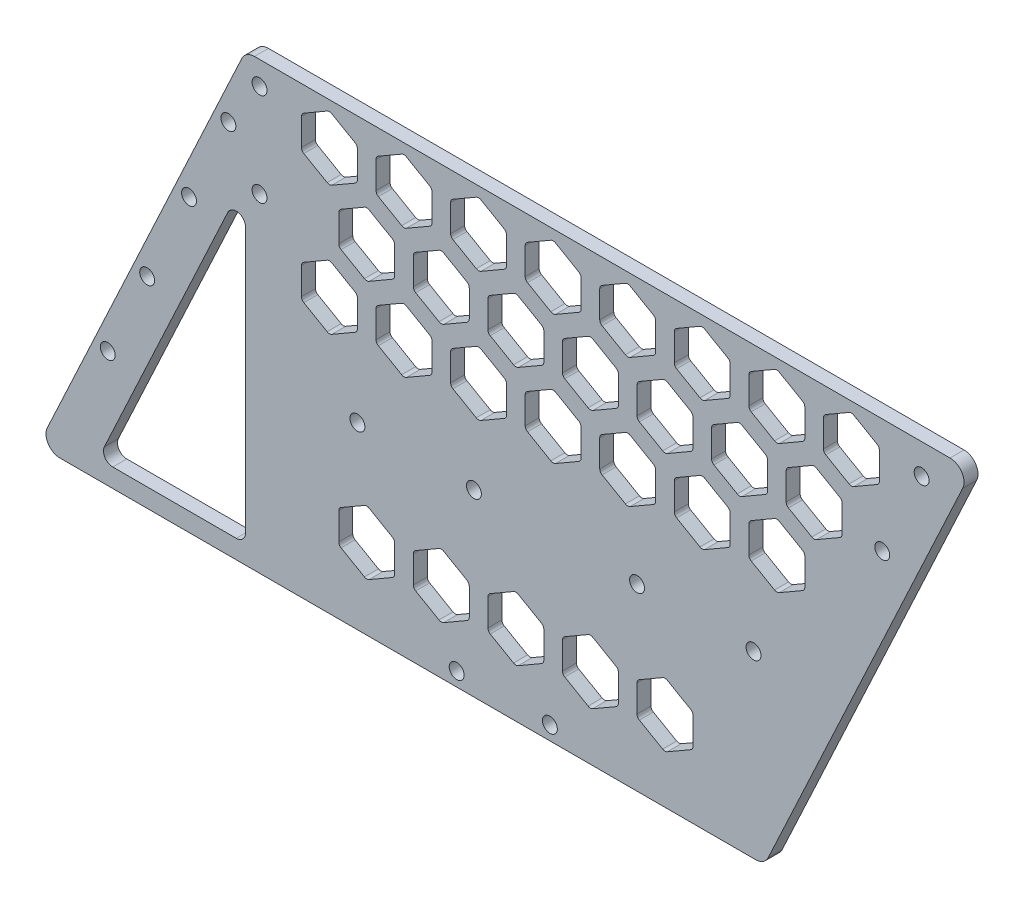
from build123d import *

# Parameters (mm, degrees)
EXTRUDE_1_DEPTH     = 3
CUT_EXTRUDE_1_REACH = 186.492
SKETCH_2_R          = 1.6
CUT_EXTRUDE_3_REACH = 186.492
SKETCH_4_R          = 1.6
CUT_EXTRUDE_4_REACH = 186.492
OTHER_1_DEPTH       = 3
CUT_EXTRUDE_5_REACH = 186.492
SKETCH_7_R          = 1.6
CUT_EXTRUDE_6_DEPTH = 10
SKETCH_9_R          = 1.6
CUT_EXTRUDE_7_DEPTH = 10
CUT_EXTRUDE_8_DEPTH = 10
FILLET_1_R          = 3
SKETCH_11_R         = 1.6
CUT_EXTRUDE_9_DEPTH = 10


# Read off the part's stored shape, not the designer's step: 填充阵列1
with BuildPart() as part:
    # 草图1 → 凸台-拉伸1 (new body)
    with BuildSketch(Plane.XY):
        with BuildLine():
            Line((0, 0), (113.088789218, 0))
            ThreePointArc((113.088789218, 0), (114.700688043, 0.469825663), (115.807712579, 1.732145215))
            Line((115.807712579, 1.732145215), (157.542247984, 91.232145215))
            ThreePointArc((157.542247984, 91.232145215), (157.35349896, 94.111898825), (154.823324622, 95.5))
            Line((154.823324622, 95.5), (0, 95.5))
            Line((0, 95.5), (-7.088789218, 95.5))
            ThreePointArc((-7.088789218, 95.5), (-8.700688043, 95.030174337), (-9.807712579, 93.767854785))
            Line((-9.807712579, 93.767854785), (-51.542247984, 4.267854785))
            ThreePointArc((-51.542247984, 4.267854785), (-51.35349896, 1.388101175), (-48.823324622, 0))
            Line((-48.823324622, 0), (0, 0))
        make_face()
    extrude(amount=EXTRUDE_1_DEPTH)

    # 草图2 → 切除-拉伸1 (cut, up to next)
    with BuildSketch(Plane.XY.offset(3), mode=Mode.PRIVATE) as cut_extrude_1_sk1:
        with Locations((15, 38.5)):
            Circle(SKETCH_2_R)
    cut_extrude_1_tool1 = extrude(cut_extrude_1_sk1.sketch, amount=-CUT_EXTRUDE_1_REACH, mode=Mode.PRIVATE) & part.part
    # 草图2 → 切除-拉伸1 (cut, up to next)
    with BuildSketch(Plane.XY.offset(3), mode=Mode.PRIVATE) as cut_extrude_1_sk2:
        with Locations((40, 38.5)):
            Circle(SKETCH_2_R)
    cut_extrude_1_tool2 = extrude(cut_extrude_1_sk2.sketch, amount=-CUT_EXTRUDE_1_REACH, mode=Mode.PRIVATE) & part.part
    # 草图2 → 切除-拉伸1 (cut, up to next)
    with BuildSketch(Plane.XY.offset(3), mode=Mode.PRIVATE) as cut_extrude_1_sk3:
        with Locations((75, 38.5)):
            Circle(SKETCH_2_R)
    cut_extrude_1_tool3 = extrude(cut_extrude_1_sk3.sketch, amount=-CUT_EXTRUDE_1_REACH, mode=Mode.PRIVATE) & part.part
    # 草图2 → 切除-拉伸1 (cut, up to next)
    with BuildSketch(Plane.XY.offset(3), mode=Mode.PRIVATE) as cut_extrude_1_sk4:
        with Locations((100, 38.5)):
            Circle(SKETCH_2_R)
    cut_extrude_1_tool4 = extrude(cut_extrude_1_sk4.sketch, amount=-CUT_EXTRUDE_1_REACH, mode=Mode.PRIVATE) & part.part
    add(cut_extrude_1_tool1.solids().sort_by_distance((15, 38.5, 3))[0], mode=Mode.SUBTRACT)
    add(cut_extrude_1_tool2.solids().sort_by_distance((40, 38.5, 3))[0], mode=Mode.SUBTRACT)
    add(cut_extrude_1_tool3.solids().sort_by_distance((75, 38.5, 3))[0], mode=Mode.SUBTRACT)
    add(cut_extrude_1_tool4.solids().sort_by_distance((100, 38.5, 3))[0], mode=Mode.SUBTRACT)

    # 草图4 → 切除-拉伸3 (cut, up to next)
    with BuildSketch(Plane.XY.offset(3), mode=Mode.PRIVATE) as cut_extrude_3_sk1:
        with Locations((136.072733418, 89.06)):
            Circle(SKETCH_4_R)
    cut_extrude_3_tool1 = extrude(cut_extrude_3_sk1.sketch, amount=-CUT_EXTRUDE_3_REACH, mode=Mode.PRIVATE) & part.part
    # 草图4 → 切除-拉伸3 (cut, up to next)
    with BuildSketch(Plane.XY.offset(3), mode=Mode.PRIVATE) as cut_extrude_3_sk2:
        with Locations((127.620368183, 70.933844259)):
            Circle(SKETCH_4_R)
    cut_extrude_3_tool2 = extrude(cut_extrude_3_sk2.sketch, amount=-CUT_EXTRUDE_3_REACH, mode=Mode.PRIVATE) & part.part
    add(cut_extrude_3_tool1.solids().sort_by_distance((136.072733, 89.06, 3))[0], mode=Mode.SUBTRACT)
    add(cut_extrude_3_tool2.solids().sort_by_distance((127.620368, 70.933844, 3))[0], mode=Mode.SUBTRACT)

    # 草图5 → 切除-拉伸4 (cut, up to next)
    with BuildSketch(Plane.XY.offset(3), mode=Mode.PRIVATE) as cut_extrude_4_sk1:
        with BuildLine():
            Line((9.5, 79.860471904), (14.5, 82.74722325))
            ThreePointArc((14.5, 82.74722325), (14.866025404, 83.113248654), (15, 83.613248654))
            Line((15, 83.613248654), (15, 89.386751346))
            ThreePointArc((15, 89.386751346), (14.866025404, 89.886751346), (14.5, 90.25277675))
            Line((14.5, 90.25277675), (9.5, 93.139528096))
            ThreePointArc((9.5, 93.139528096), (9, 93.273502692), (8.5, 93.139528096))
            Line((8.5, 93.139528096), (3.5, 90.25277675))
            ThreePointArc((3.5, 90.25277675), (3.133974596, 89.886751346), (3, 89.386751346))
            Line((3, 89.386751346), (3, 83.613248654))
            ThreePointArc((3, 83.613248654), (3.133974596, 83.113248654), (3.5, 82.74722325))
            Line((3.5, 82.74722325), (8.5, 79.860471904))
            ThreePointArc((8.5, 79.860471904), (9, 79.726497308), (9.5, 79.860471904))
        make_face()
    cut_extrude_4_tool1 = extrude(cut_extrude_4_sk1.sketch, amount=-CUT_EXTRUDE_4_REACH, mode=Mode.PRIVATE) & part.part
    add(cut_extrude_4_tool1.solids().sort_by_distance((9, 86.5, 3))[0], mode=Mode.SUBTRACT)

    # 填充阵列1 outline → 填充阵列1 (cut)
    with BuildSketch(Plane.XY):
        with BuildLine():
            ThreePointArc((27, 69.756842194), (27.133974596, 69.256842194), (27.5, 68.89081679))
            Line((27.5, 68.89081679), (32.5, 66.004065444))
            ThreePointArc((32.5, 66.004065444), (33, 65.870090848), (33.5, 66.004065444))
            Line((33.5, 66.004065444), (38.5, 68.89081679))
            ThreePointArc((38.5, 68.89081679), (38.866025404, 69.256842194), (39, 69.756842194))
            Line((39, 69.756842194), (39, 75.530344885))
            ThreePointArc((39, 75.530344885), (38.866025404, 76.030344885), (38.5, 76.396370289))
            Line((38.5, 76.396370289), (33.5, 79.283121635))
            ThreePointArc((33.5, 79.283121635), (33, 79.417096231), (32.5, 79.283121635))
            Line((32.5, 79.283121635), (27.5, 76.396370289))
            ThreePointArc((27.5, 76.396370289), (27.133974596, 76.030344885), (27, 75.530344885))
            Line((27, 75.530344885), (27, 69.756842194))
        make_face()
        with BuildLine():
            ThreePointArc((51, 55.900435733), (51.133974596, 55.400435733), (51.5, 55.034410329))
            Line((51.5, 55.034410329), (56.5, 52.147658983))
            ThreePointArc((56.5, 52.147658983), (57, 52.013684387), (57.5, 52.147658983))
            Line((57.5, 52.147658983), (62.5, 55.034410329))
            ThreePointArc((62.5, 55.034410329), (62.866025404, 55.400435733), (63, 55.900435733))
            Line((63, 55.900435733), (63, 61.673938425))
            ThreePointArc((63, 61.673938425), (62.866025404, 62.173938425), (62.5, 62.539963829))
            Line((62.5, 62.539963829), (57.5, 65.426715175))
            ThreePointArc((57.5, 65.426715175), (57, 65.560689771), (56.5, 65.426715175))
            Line((56.5, 65.426715175), (51.5, 62.539963829))
            ThreePointArc((51.5, 62.539963829), (51.133974596, 62.173938425), (51, 61.673938425))
            Line((51, 61.673938425), (51, 55.900435733))
        make_face()
        with BuildLine():
            ThreePointArc((3.5, 62.539963829), (3.133974596, 62.173938425), (3, 61.673938425))
            Line((3, 61.673938425), (3, 55.900435733))
            ThreePointArc((3, 55.900435733), (3.133974596, 55.400435733), (3.5, 55.034410329))
            Line((3.5, 55.034410329), (8.5, 52.147658983))
            ThreePointArc((8.5, 52.147658983), (9, 52.013684387), (9.5, 52.147658983))
            Line((9.5, 52.147658983), (14.5, 55.034410329))
            ThreePointArc((14.5, 55.034410329), (14.866025404, 55.400435733), (15, 55.900435733))
            Line((15, 55.900435733), (15, 61.673938425))
            ThreePointArc((15, 61.673938425), (14.866025404, 62.173938425), (14.5, 62.539963829))
            Line((14.5, 62.539963829), (9.5, 65.426715175))
            ThreePointArc((9.5, 65.426715175), (9, 65.560689771), (8.5, 65.426715175))
            Line((8.5, 65.426715175), (3.5, 62.539963829))
        make_face()
        with BuildLine():
            Line((121.5, 79.860471904), (126.5, 82.74722325))
            ThreePointArc((126.5, 82.74722325), (126.866025404, 83.113248654), (127, 83.613248654))
            Line((127, 83.613248654), (127, 89.386751346))
            ThreePointArc((127, 89.386751346), (126.866025404, 89.886751346), (126.5, 90.25277675))
            Line((126.5, 90.25277675), (121.5, 93.139528096))
            ThreePointArc((121.5, 93.139528096), (121, 93.273502692), (120.5, 93.139528096))
            Line((120.5, 93.139528096), (115.5, 90.25277675))
            ThreePointArc((115.5, 90.25277675), (115.133974596, 89.886751346), (115, 89.386751346))
            Line((115, 89.386751346), (115, 83.613248654))
            ThreePointArc((115, 83.613248654), (115.133974596, 83.113248654), (115.5, 82.74722325))
            Line((115.5, 82.74722325), (120.5, 79.860471904))
            ThreePointArc((120.5, 79.860471904), (121, 79.726497308), (121.5, 79.860471904))
        make_face()
        with BuildLine():
            ThreePointArc((96.5, 66.004065444), (97, 65.870090848), (97.5, 66.004065444))
            Line((97.5, 66.004065444), (102.5, 68.89081679))
            ThreePointArc((102.5, 68.89081679), (102.866025404, 69.256842194), (103, 69.756842194))
            Line((103, 69.756842194), (103, 75.530344885))
            ThreePointArc((103, 75.530344885), (102.866025404, 76.030344885), (102.5, 76.396370289))
            Line((102.5, 76.396370289), (97.5, 79.283121635))
            ThreePointArc((97.5, 79.283121635), (97, 79.417096231), (96.5, 79.283121635))
            Line((96.5, 79.283121635), (91.5, 76.396370289))
            ThreePointArc((91.5, 76.396370289), (91.133974596, 76.030344885), (91, 75.530344885))
            Line((91, 75.530344885), (91, 69.756842194))
            ThreePointArc((91, 69.756842194), (91.133974596, 69.256842194), (91.5, 68.89081679))
            Line((91.5, 68.89081679), (96.5, 66.004065444))
        make_face()
        with BuildLine():
            ThreePointArc((72.5, 52.147658983), (73, 52.013684387), (73.5, 52.147658983))
            Line((73.5, 52.147658983), (78.5, 55.034410329))
            ThreePointArc((78.5, 55.034410329), (78.866025404, 55.400435733), (79, 55.900435733))
            Line((79, 55.900435733), (79, 61.673938425))
            ThreePointArc((79, 61.673938425), (78.866025404, 62.173938425), (78.5, 62.539963829))
            Line((78.5, 62.539963829), (73.5, 65.426715175))
            ThreePointArc((73.5, 65.426715175), (73, 65.560689771), (72.5, 65.426715175))
            Line((72.5, 65.426715175), (67.5, 62.539963829))
            ThreePointArc((67.5, 62.539963829), (67.133974596, 62.173938425), (67, 61.673938425))
            Line((67, 61.673938425), (67, 55.900435733))
            ThreePointArc((67, 55.900435733), (67.133974596, 55.400435733), (67.5, 55.034410329))
            Line((67.5, 55.034410329), (72.5, 52.147658983))
        make_face()
        with BuildLine():
            ThreePointArc((56.5, 79.860471904), (57, 79.726497308), (57.5, 79.860471904))
            Line((57.5, 79.860471904), (62.5, 82.74722325))
            ThreePointArc((62.5, 82.74722325), (62.866025404, 83.113248654), (63, 83.613248654))
            Line((63, 83.613248654), (63, 89.386751346))
            ThreePointArc((63, 89.386751346), (62.866025404, 89.886751346), (62.5, 90.25277675))
            Line((62.5, 90.25277675), (57.5, 93.139528096))
            ThreePointArc((57.5, 93.139528096), (57, 93.273502692), (56.5, 93.139528096))
            Line((56.5, 93.139528096), (51.5, 90.25277675))
            ThreePointArc((51.5, 90.25277675), (51.133974596, 89.886751346), (51, 89.386751346))
            Line((51, 89.386751346), (51, 83.613248654))
            ThreePointArc((51, 83.613248654), (51.133974596, 83.113248654), (51.5, 82.74722325))
            Line((51.5, 82.74722325), (56.5, 79.860471904))
        make_face()
        with BuildLine():
            ThreePointArc((27.5, 20.970744447), (27.133974596, 20.604719043), (27, 20.104719043))
            Line((27, 20.104719043), (27, 14.331216351))
            ThreePointArc((27, 14.331216351), (27.133974596, 13.831216351), (27.5, 13.465190948))
            Line((27.5, 13.465190948), (32.5, 10.578439602))
            ThreePointArc((32.5, 10.578439602), (33, 10.444465005), (33.5, 10.578439602))
            Line((33.5, 10.578439602), (38.5, 13.465190948))
            ThreePointArc((38.5, 13.465190948), (38.866025404, 13.831216351), (39, 14.331216351))
            Line((39, 14.331216351), (39, 20.104719043))
            ThreePointArc((39, 20.104719043), (38.866025404, 20.604719043), (38.5, 20.970744447))
            Line((38.5, 20.970744447), (33.5, 23.857495793))
            ThreePointArc((33.5, 23.857495793), (33, 23.991470389), (32.5, 23.857495793))
            Line((32.5, 23.857495793), (27.5, 20.970744447))
        make_face()
        with BuildLine():
            Line((25.5, 52.147658983), (30.5, 55.034410329))
            ThreePointArc((30.5, 55.034410329), (30.866025404, 55.400435733), (31, 55.900435733))
            Line((31, 55.900435733), (31, 61.673938425))
            ThreePointArc((31, 61.673938425), (30.866025404, 62.173938425), (30.5, 62.539963829))
            Line((30.5, 62.539963829), (25.5, 65.426715175))
            ThreePointArc((25.5, 65.426715175), (25, 65.560689771), (24.5, 65.426715175))
            Line((24.5, 65.426715175), (19.5, 62.539963829))
            ThreePointArc((19.5, 62.539963829), (19.133974596, 62.173938425), (19, 61.673938425))
            Line((19, 61.673938425), (19, 55.900435733))
            ThreePointArc((19, 55.900435733), (19.133974596, 55.400435733), (19.5, 55.034410329))
            Line((19.5, 55.034410329), (24.5, 52.147658983))
            ThreePointArc((24.5, 52.147658983), (25, 52.013684387), (25.5, 52.147658983))
        make_face()
        with BuildLine():
            ThreePointArc((48.5, 66.004065444), (49, 65.870090848), (49.5, 66.004065444))
            Line((49.5, 66.004065444), (54.5, 68.89081679))
            ThreePointArc((54.5, 68.89081679), (54.866025404, 69.256842194), (55, 69.756842194))
            Line((55, 69.756842194), (55, 75.530344885))
            ThreePointArc((55, 75.530344885), (54.866025404, 76.030344885), (54.5, 76.396370289))
            Line((54.5, 76.396370289), (49.5, 79.283121635))
            ThreePointArc((49.5, 79.283121635), (49, 79.417096231), (48.5, 79.283121635))
            Line((48.5, 79.283121635), (43.5, 76.396370289))
            ThreePointArc((43.5, 76.396370289), (43.133974596, 76.030344885), (43, 75.530344885))
            Line((43, 75.530344885), (43, 69.756842194))
            ThreePointArc((43, 69.756842194), (43.133974596, 69.256842194), (43.5, 68.89081679))
            Line((43.5, 68.89081679), (48.5, 66.004065444))
        make_face()
        with BuildLine():
            ThreePointArc((72.5, 79.860471904), (73, 79.726497308), (73.5, 79.860471904))
            Line((73.5, 79.860471904), (78.5, 82.74722325))
            ThreePointArc((78.5, 82.74722325), (78.866025404, 83.113248654), (79, 83.613248654))
            Line((79, 83.613248654), (79, 89.386751346))
            ThreePointArc((79, 89.386751346), (78.866025404, 89.886751346), (78.5, 90.25277675))
            Line((78.5, 90.25277675), (73.5, 93.139528096))
            ThreePointArc((73.5, 93.139528096), (73, 93.273502692), (72.5, 93.139528096))
            Line((72.5, 93.139528096), (67.5, 90.25277675))
            ThreePointArc((67.5, 90.25277675), (67.133974596, 89.886751346), (67, 89.386751346))
            Line((67, 89.386751346), (67, 83.613248654))
            ThreePointArc((67, 83.613248654), (67.133974596, 83.113248654), (67.5, 82.74722325))
            Line((67.5, 82.74722325), (72.5, 79.860471904))
        make_face()
        with BuildLine():
            ThreePointArc((19.5, 90.25277675), (19.133974596, 89.886751346), (19, 89.386751346))
            Line((19, 89.386751346), (19, 83.613248654))
            ThreePointArc((19, 83.613248654), (19.133974596, 83.113248654), (19.5, 82.74722325))
            Line((19.5, 82.74722325), (24.5, 79.860471904))
            ThreePointArc((24.5, 79.860471904), (25, 79.726497308), (25.5, 79.860471904))
            Line((25.5, 79.860471904), (30.5, 82.74722325))
            ThreePointArc((30.5, 82.74722325), (30.866025404, 83.113248654), (31, 83.613248654))
            Line((31, 83.613248654), (31, 89.386751346))
            ThreePointArc((31, 89.386751346), (30.866025404, 89.886751346), (30.5, 90.25277675))
            Line((30.5, 90.25277675), (25.5, 93.139528096))
            ThreePointArc((25.5, 93.139528096), (25, 93.273502692), (24.5, 93.139528096))
            Line((24.5, 93.139528096), (19.5, 90.25277675))
        make_face()
        with BuildLine():
            Line((17.5, 66.004065444), (22.5, 68.89081679))
            ThreePointArc((22.5, 68.89081679), (22.866025404, 69.256842194), (23, 69.756842194))
            Line((23, 69.756842194), (23, 75.530344885))
            ThreePointArc((23, 75.530344885), (22.866025404, 76.030344885), (22.5, 76.396370289))
            Line((22.5, 76.396370289), (17.5, 79.283121635))
            ThreePointArc((17.5, 79.283121635), (17, 79.417096231), (16.5, 79.283121635))
            Line((16.5, 79.283121635), (11.5, 76.396370289))
            ThreePointArc((11.5, 76.396370289), (11.133974596, 76.030344885), (11, 75.530344885))
            Line((11, 75.530344885), (11, 69.756842194))
            ThreePointArc((11, 69.756842194), (11.133974596, 69.256842194), (11.5, 68.89081679))
            Line((11.5, 68.89081679), (16.5, 66.004065444))
            ThreePointArc((16.5, 66.004065444), (17, 65.870090848), (17.5, 66.004065444))
        make_face()
        with BuildLine():
            ThreePointArc((40.5, 79.860471904), (41, 79.726497308), (41.5, 79.860471904))
            Line((41.5, 79.860471904), (46.5, 82.74722325))
            ThreePointArc((46.5, 82.74722325), (46.866025404, 83.113248654), (47, 83.613248654))
            Line((47, 83.613248654), (47, 89.386751346))
            ThreePointArc((47, 89.386751346), (46.866025404, 89.886751346), (46.5, 90.25277675))
            Line((46.5, 90.25277675), (41.5, 93.139528096))
            ThreePointArc((41.5, 93.139528096), (41, 93.273502692), (40.5, 93.139528096))
            Line((40.5, 93.139528096), (35.5, 90.25277675))
            ThreePointArc((35.5, 90.25277675), (35.133974596, 89.886751346), (35, 89.386751346))
            Line((35, 89.386751346), (35, 83.613248654))
            ThreePointArc((35, 83.613248654), (35.133974596, 83.113248654), (35.5, 82.74722325))
            Line((35.5, 82.74722325), (40.5, 79.860471904))
        make_face()
        with BuildLine():
            ThreePointArc((35, 55.900435733), (35.133974596, 55.400435733), (35.5, 55.034410329))
            Line((35.5, 55.034410329), (40.5, 52.147658983))
            ThreePointArc((40.5, 52.147658983), (41, 52.013684387), (41.5, 52.147658983))
            Line((41.5, 52.147658983), (46.5, 55.034410329))
            ThreePointArc((46.5, 55.034410329), (46.866025404, 55.400435733), (47, 55.900435733))
            Line((47, 55.900435733), (47, 61.673938425))
            ThreePointArc((47, 61.673938425), (46.866025404, 62.173938425), (46.5, 62.539963829))
            Line((46.5, 62.539963829), (41.5, 65.426715175))
            ThreePointArc((41.5, 65.426715175), (41, 65.560689771), (40.5, 65.426715175))
            Line((40.5, 65.426715175), (35.5, 62.539963829))
            ThreePointArc((35.5, 62.539963829), (35.133974596, 62.173938425), (35, 61.673938425))
            Line((35, 61.673938425), (35, 55.900435733))
        make_face()
        with BuildLine():
            ThreePointArc((11.5, 20.970744447), (11.133974596, 20.604719043), (11, 20.104719043))
            Line((11, 20.104719043), (11, 14.331216351))
            ThreePointArc((11, 14.331216351), (11.133974596, 13.831216351), (11.5, 13.465190948))
            Line((11.5, 13.465190948), (16.5, 10.578439602))
            ThreePointArc((16.5, 10.578439602), (17, 10.444465005), (17.5, 10.578439602))
            Line((17.5, 10.578439602), (22.5, 13.465190948))
            ThreePointArc((22.5, 13.465190948), (22.866025404, 13.831216351), (23, 14.331216351))
            Line((23, 14.331216351), (23, 20.104719043))
            ThreePointArc((23, 20.104719043), (22.866025404, 20.604719043), (22.5, 20.970744447))
            Line((22.5, 20.970744447), (17.5, 23.857495793))
            ThreePointArc((17.5, 23.857495793), (17, 23.991470389), (16.5, 23.857495793))
            Line((16.5, 23.857495793), (11.5, 20.970744447))
        make_face()
        with BuildLine():
            ThreePointArc((43.5, 20.970744447), (43.133974596, 20.604719043), (43, 20.104719043))
            Line((43, 20.104719043), (43, 14.331216351))
            ThreePointArc((43, 14.331216351), (43.133974596, 13.831216351), (43.5, 13.465190948))
            Line((43.5, 13.465190948), (48.5, 10.578439602))
            ThreePointArc((48.5, 10.578439602), (49, 10.444465005), (49.5, 10.578439602))
            Line((49.5, 10.578439602), (54.5, 13.465190948))
            ThreePointArc((54.5, 13.465190948), (54.866025404, 13.831216351), (55, 14.331216351))
            Line((55, 14.331216351), (55, 20.104719043))
            ThreePointArc((55, 20.104719043), (54.866025404, 20.604719043), (54.5, 20.970744447))
            Line((54.5, 20.970744447), (49.5, 23.857495793))
            ThreePointArc((49.5, 23.857495793), (49, 23.991470389), (48.5, 23.857495793))
            Line((48.5, 23.857495793), (43.5, 20.970744447))
        make_face()
        with BuildLine():
            ThreePointArc((88.5, 79.860471904), (89, 79.726497308), (89.5, 79.860471904))
            Line((89.5, 79.860471904), (94.5, 82.74722325))
            ThreePointArc((94.5, 82.74722325), (94.866025404, 83.113248654), (95, 83.613248654))
            Line((95, 83.613248654), (95, 89.386751346))
            ThreePointArc((95, 89.386751346), (94.866025404, 89.886751346), (94.5, 90.25277675))
            Line((94.5, 90.25277675), (89.5, 93.139528096))
            ThreePointArc((89.5, 93.139528096), (89, 93.273502692), (88.5, 93.139528096))
            Line((88.5, 93.139528096), (83.5, 90.25277675))
            ThreePointArc((83.5, 90.25277675), (83.133974596, 89.886751346), (83, 89.386751346))
            Line((83, 89.386751346), (83, 83.613248654))
            ThreePointArc((83, 83.613248654), (83.133974596, 83.113248654), (83.5, 82.74722325))
            Line((83.5, 82.74722325), (88.5, 79.860471904))
        make_face()
        with BuildLine():
            ThreePointArc((64.5, 66.004065444), (65, 65.870090848), (65.5, 66.004065444))
            Line((65.5, 66.004065444), (70.5, 68.89081679))
            ThreePointArc((70.5, 68.89081679), (70.866025404, 69.256842194), (71, 69.756842194))
            Line((71, 69.756842194), (71, 75.530344885))
            ThreePointArc((71, 75.530344885), (70.866025404, 76.030344885), (70.5, 76.396370289))
            Line((70.5, 76.396370289), (65.5, 79.283121635))
            ThreePointArc((65.5, 79.283121635), (65, 79.417096231), (64.5, 79.283121635))
            Line((64.5, 79.283121635), (59.5, 76.396370289))
            ThreePointArc((59.5, 76.396370289), (59.133974596, 76.030344885), (59, 75.530344885))
            Line((59, 75.530344885), (59, 69.756842194))
            ThreePointArc((59, 69.756842194), (59.133974596, 69.256842194), (59.5, 68.89081679))
            Line((59.5, 68.89081679), (64.5, 66.004065444))
        make_face()
        with BuildLine():
            ThreePointArc((88.5, 52.147658983), (89, 52.013684387), (89.5, 52.147658983))
            Line((89.5, 52.147658983), (94.5, 55.034410329))
            ThreePointArc((94.5, 55.034410329), (94.866025404, 55.400435733), (95, 55.900435733))
            Line((95, 55.900435733), (95, 61.673938425))
            ThreePointArc((95, 61.673938425), (94.866025404, 62.173938425), (94.5, 62.539963829))
            Line((94.5, 62.539963829), (89.5, 65.426715175))
            ThreePointArc((89.5, 65.426715175), (89, 65.560689771), (88.5, 65.426715175))
            Line((88.5, 65.426715175), (83.5, 62.539963829))
            ThreePointArc((83.5, 62.539963829), (83.133974596, 62.173938425), (83, 61.673938425))
            Line((83, 61.673938425), (83, 55.900435733))
            ThreePointArc((83, 55.900435733), (83.133974596, 55.400435733), (83.5, 55.034410329))
            Line((83.5, 55.034410329), (88.5, 52.147658983))
        make_face()
        with BuildLine():
            ThreePointArc((112.5, 66.004065444), (113, 65.870090848), (113.5, 66.004065444))
            Line((113.5, 66.004065444), (118.5, 68.89081679))
            ThreePointArc((118.5, 68.89081679), (118.866025404, 69.256842194), (119, 69.756842194))
            Line((119, 69.756842194), (119, 75.530344885))
            ThreePointArc((119, 75.530344885), (118.866025404, 76.030344885), (118.5, 76.396370289))
            Line((118.5, 76.396370289), (113.5, 79.283121635))
            ThreePointArc((113.5, 79.283121635), (113, 79.417096231), (112.5, 79.283121635))
            Line((112.5, 79.283121635), (107.5, 76.396370289))
            ThreePointArc((107.5, 76.396370289), (107.133974596, 76.030344885), (107, 75.530344885))
            Line((107, 75.530344885), (107, 69.756842194))
            ThreePointArc((107, 69.756842194), (107.133974596, 69.256842194), (107.5, 68.89081679))
            Line((107.5, 68.89081679), (112.5, 66.004065444))
        make_face()
        with BuildLine():
            ThreePointArc((75, 14.331216351), (75.133974596, 13.831216351), (75.5, 13.465190948))
            Line((75.5, 13.465190948), (80.5, 10.578439602))
            ThreePointArc((80.5, 10.578439602), (81, 10.444465005), (81.5, 10.578439602))
            Line((81.5, 10.578439602), (86.5, 13.465190948))
            ThreePointArc((86.5, 13.465190948), (86.866025404, 13.831216351), (87, 14.331216351))
            Line((87, 14.331216351), (87, 20.104719043))
            ThreePointArc((87, 20.104719043), (86.866025404, 20.604719043), (86.5, 20.970744447))
            Line((86.5, 20.970744447), (81.5, 23.857495793))
            ThreePointArc((81.5, 23.857495793), (81, 23.991470389), (80.5, 23.857495793))
            Line((80.5, 23.857495793), (75.5, 20.970744447))
            ThreePointArc((75.5, 20.970744447), (75.133974596, 20.604719043), (75, 20.104719043))
            Line((75, 20.104719043), (75, 14.331216351))
        make_face()
        with BuildLine():
            Line((65.5, 10.578439602), (70.5, 13.465190948))
            ThreePointArc((70.5, 13.465190948), (70.866025404, 13.831216351), (71, 14.331216351))
            Line((71, 14.331216351), (71, 20.104719043))
            ThreePointArc((71, 20.104719043), (70.866025404, 20.604719043), (70.5, 20.970744447))
            Line((70.5, 20.970744447), (65.5, 23.857495793))
            ThreePointArc((65.5, 23.857495793), (65, 23.991470389), (64.5, 23.857495793))
            Line((64.5, 23.857495793), (59.5, 20.970744447))
            ThreePointArc((59.5, 20.970744447), (59.133974596, 20.604719043), (59, 20.104719043))
            Line((59, 20.104719043), (59, 14.331216351))
            ThreePointArc((59, 14.331216351), (59.133974596, 13.831216351), (59.5, 13.465190948))
            Line((59.5, 13.465190948), (64.5, 10.578439602))
            ThreePointArc((64.5, 10.578439602), (65, 10.444465005), (65.5, 10.578439602))
        make_face()
        with BuildLine():
            Line((105.5, 52.147658983), (110.5, 55.034410329))
            ThreePointArc((110.5, 55.034410329), (110.866025404, 55.400435733), (111, 55.900435733))
            Line((111, 55.900435733), (111, 61.673938425))
            ThreePointArc((111, 61.673938425), (110.866025404, 62.173938425), (110.5, 62.539963829))
            Line((110.5, 62.539963829), (105.5, 65.426715175))
            ThreePointArc((105.5, 65.426715175), (105, 65.560689771), (104.5, 65.426715175))
            Line((104.5, 65.426715175), (99.5, 62.539963829))
            ThreePointArc((99.5, 62.539963829), (99.133974596, 62.173938425), (99, 61.673938425))
            Line((99, 61.673938425), (99, 55.900435733))
            ThreePointArc((99, 55.900435733), (99.133974596, 55.400435733), (99.5, 55.034410329))
            Line((99.5, 55.034410329), (104.5, 52.147658983))
            ThreePointArc((104.5, 52.147658983), (105, 52.013684387), (105.5, 52.147658983))
        make_face()
        with BuildLine():
            ThreePointArc((75, 69.756842194), (75.133974596, 69.256842194), (75.5, 68.89081679))
            Line((75.5, 68.89081679), (80.5, 66.004065444))
            ThreePointArc((80.5, 66.004065444), (81, 65.870090848), (81.5, 66.004065444))
            Line((81.5, 66.004065444), (86.5, 68.89081679))
            ThreePointArc((86.5, 68.89081679), (86.866025404, 69.256842194), (87, 69.756842194))
            Line((87, 69.756842194), (87, 75.530344885))
            ThreePointArc((87, 75.530344885), (86.866025404, 76.030344885), (86.5, 76.396370289))
            Line((86.5, 76.396370289), (81.5, 79.283121635))
            ThreePointArc((81.5, 79.283121635), (81, 79.417096231), (80.5, 79.283121635))
            Line((80.5, 79.283121635), (75.5, 76.396370289))
            ThreePointArc((75.5, 76.396370289), (75.133974596, 76.030344885), (75, 75.530344885))
            Line((75, 75.530344885), (75, 69.756842194))
        make_face()
        with BuildLine():
            ThreePointArc((99.5, 90.25277675), (99.133974596, 89.886751346), (99, 89.386751346))
            Line((99, 89.386751346), (99, 83.613248654))
            ThreePointArc((99, 83.613248654), (99.133974596, 83.113248654), (99.5, 82.74722325))
            Line((99.5, 82.74722325), (104.5, 79.860471904))
            ThreePointArc((104.5, 79.860471904), (105, 79.726497308), (105.5, 79.860471904))
            Line((105.5, 79.860471904), (110.5, 82.74722325))
            ThreePointArc((110.5, 82.74722325), (110.866025404, 83.113248654), (111, 83.613248654))
            Line((111, 83.613248654), (111, 89.386751346))
            ThreePointArc((111, 89.386751346), (110.866025404, 89.886751346), (110.5, 90.25277675))
            Line((110.5, 90.25277675), (105.5, 93.139528096))
            ThreePointArc((105.5, 93.139528096), (105, 93.273502692), (104.5, 93.139528096))
            Line((104.5, 93.139528096), (99.5, 90.25277675))
        make_face()
    extrude(amount=OTHER_1_DEPTH, mode=Mode.SUBTRACT)

    # 草图7 → 切除-拉伸5 (cut, up to next)
    with BuildSketch(Plane.XY.offset(3), mode=Mode.PRIVATE) as cut_extrude_5_sk1:
        with Locations((-6, 90.5)):
            Circle(SKETCH_7_R)
    cut_extrude_5_tool1 = extrude(cut_extrude_5_sk1.sketch, amount=-CUT_EXTRUDE_5_REACH, mode=Mode.PRIVATE) & part.part
    # 草图7 → 切除-拉伸5 (cut, up to next)
    with BuildSketch(Plane.XY.offset(3), mode=Mode.PRIVATE) as cut_extrude_5_sk2:
        with Locations((-6, 70.5)):
            Circle(SKETCH_7_R)
    cut_extrude_5_tool2 = extrude(cut_extrude_5_sk2.sketch, amount=-CUT_EXTRUDE_5_REACH, mode=Mode.PRIVATE) & part.part
    add(cut_extrude_5_tool1.solids().sort_by_distance((-6, 90.5, 3))[0], mode=Mode.SUBTRACT)
    add(cut_extrude_5_tool2.solids().sort_by_distance((-6, 70.5, 3))[0], mode=Mode.SUBTRACT)

    # 草图8 → 切除-拉伸6 (cut)
    with BuildSketch(Plane.XY.offset(3)):
        with BuildLine():
            Line((-12.812615574, 63.661803685), (-39.306615951, 6.845236523))
            ThreePointArc((-39.306615951, 6.845236523), (-39.180783269, 4.925400783), (-37.494000377, 4))
            Line((-37.494000377, 4), (-11, 4))
            ThreePointArc((-11, 4), (-9.585786438, 4.585786438), (-9, 6))
            Line((-9, 6), (-9, 62.816567161))
            ThreePointArc((-9, 62.816567161), (-10.567120772, 64.769159175), (-12.812615574, 63.661803685))
        make_face()
    extrude(amount=-CUT_EXTRUDE_6_DEPTH, mode=Mode.SUBTRACT)

    # 草图9 → 切除-拉伸7 (cut)
    with BuildSketch(Plane.XY.offset(3)):
        with Locations((56.3, 3)):
            Circle(SKETCH_9_R)
        with Locations((36.3, 3)):
            Circle(SKETCH_9_R)
    extrude(amount=-CUT_EXTRUDE_7_DEPTH, mode=Mode.SUBTRACT)

    # 草图10 → 切除-拉伸8 (cut)
    with BuildSketch(Plane.XY.offset(3)):
        Polygon((146.876091472, 95.5), (102.343710118, 0), (130.705197262, 0), (181.876091472, 95.5), align=None)
    extrude(amount=-CUT_EXTRUDE_8_DEPTH, mode=Mode.SUBTRACT)

    # 圆角1
    fillet_1_edges = [part.edges().sort_by_distance(p)[0] for p in [
        (146.876091472, 95.5, 1.5),
        (102.343710118, 0, 1.5),
    ]]
    fillet(fillet_1_edges, radius=FILLET_1_R)

    # 草图11 → 切除-拉伸9 (cut)
    with BuildSketch(Plane.XY.offset(3)):
        with Locations((-12.684481115, 80.5)):
            Circle(SKETCH_11_R)
        with Locations((-21.13684635, 62.373844259)):
            Circle(SKETCH_11_R)
        with Locations((-30.112190908, 43.126155741)):
            Circle(SKETCH_11_R)
        with Locations((-38.564556143, 25)):
            Circle(SKETCH_11_R)
    extrude(amount=-CUT_EXTRUDE_9_DEPTH, mode=Mode.SUBTRACT)


solid = part.part
